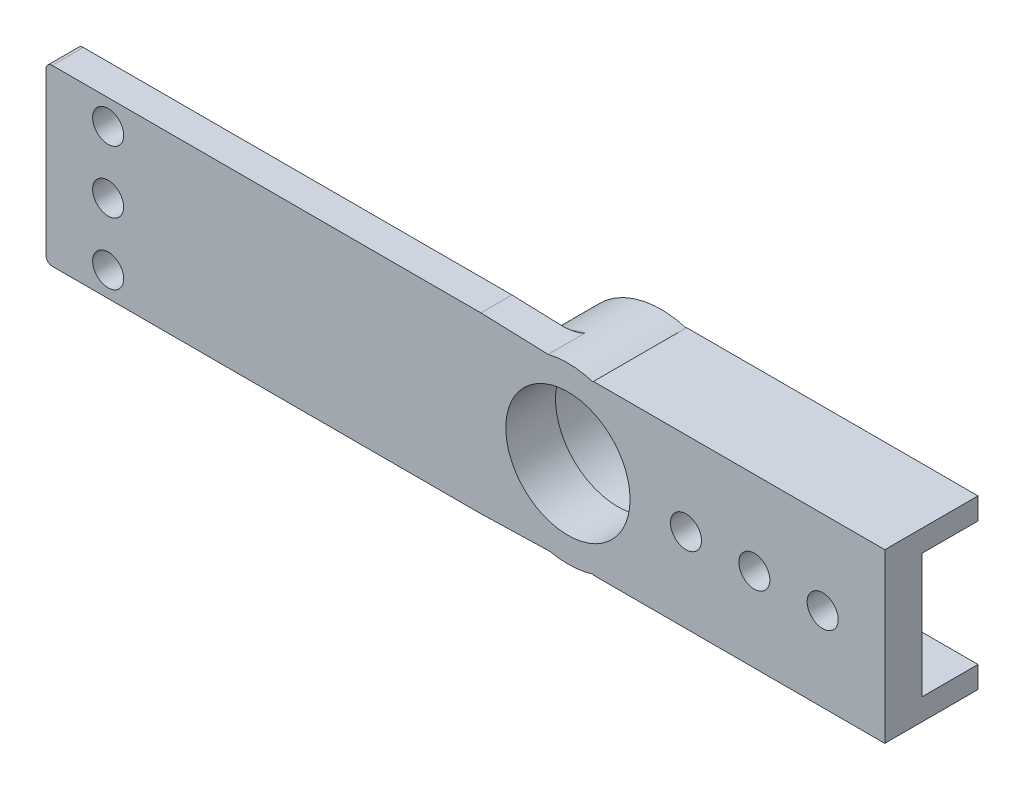
from build123d import *

# Parameters (mm, degrees)
SKETCH_1_W          = 40
SKETCH_1_H          = 20
EXTRUDE_1_DEPTH     = 6
SKETCH_2_R          = 2.5
CUT_EXTRUDE_1_DEPTH = 24.151673806
SKETCH_3_R          = 11
EXTRUDE_2_DEPTH     = 15
SKETCH_5_R          = 11
SKETCH_5_R_2        = 10
EXTRUDE_3_DEPTH     = 8
EXTRUDE_4_DEPTH     = 5
FILLET_1_R          = 1
FILLET_2_R          = 1
SKETCH_9_R          = 2.5
CUT_EXTRUDE_2_DEPTH = 5


with BuildPart() as part:
    # 草图1 → 凸台-拉伸1 (new body)
    with BuildSketch(Plane.XY):
        Rectangle(SKETCH_1_W, SKETCH_1_H)
    extrude(amount=EXTRUDE_1_DEPTH)

    # 草图2 → 切除-拉伸1 (cut, through all)
    with BuildSketch(Plane.XY.offset(6)):
        with Locations((10, 0)):
            Circle(SKETCH_2_R)
        with Locations((-1, 0)):
            Circle(SKETCH_2_R)
        with Locations((-12, 0)):
            Circle(SKETCH_2_R)
    extrude(amount=-CUT_EXTRUDE_1_DEPTH, mode=Mode.SUBTRACT)

    # 草图3 → 凸台-拉伸2 (add)
    with BuildSketch(Plane.XY.offset(6)):
        with BuildLine():
            Line((20, 10), (20, 13.5))
            Line((20, 13.5), (-26.893967141, 13.5))
            Line((-26.893967141, 13.5), (-26.893967141, 13.384337644))
            ThreePointArc((-26.893967141, 13.384337644), (-45, 0), (-26.893967141, -13.384337644))
            Line((-26.893967141, -13.384337644), (-26.893967141, -13.5))
            Line((-26.893967141, -13.5), (20, -13.5))
            Line((20, -13.5), (20, -10))
            Line((20, -10), (-20, -10))
            Line((-20, -10), (-20, -8.660254038))
            ThreePointArc((-20, -8.660254038), (-17, 0), (-20, 8.660254038))
            Line((-20, 8.660254038), (-20, 10))
            Line((-20, 10), (20, 10))
        make_face()
        with Locations((-31, 0)):
            Circle(SKETCH_3_R, mode=Mode.SUBTRACT)
    extrude(amount=-EXTRUDE_2_DEPTH)

    # 草图5 → 凸台-拉伸3 (add)
    with BuildSketch(Plane.XY.offset(6)):
        with Locations((-31, 0)):
            Circle(SKETCH_5_R)
        with Locations((-31, 0)):
            Circle(SKETCH_5_R_2, mode=Mode.SUBTRACT)
    extrude(amount=-EXTRUDE_3_DEPTH)

    # 草图8 → 凸台-拉伸4 (add)
    with BuildSketch(Plane.XY.offset(6)):
        with BuildLine():
            ThreePointArc((-33.911999365, -13.693803697), (-44.999289152, -0.141078849), (-34.187380521, 13.632336755))
            Line((-34.187380521, 13.632336755), (-45, 14))
            Line((-45, 14), (-115, 14))
            Line((-115, 14), (-115, -14))
            Line((-115, -14), (-45, -14))
            Line((-45, -14), (-33.911999365, -13.693803697))
        make_face()
    extrude(amount=-EXTRUDE_4_DEPTH)

    # 圆角1
    fillet_1_edges = [part.edges().sort_by_distance(p)[0] for p in [
        (-44.999289152, -0.141078849, 1),
    ]]
    fillet(fillet_1_edges, radius=FILLET_1_R)

    # 圆角2
    fillet_2_edges = [part.edges().sort_by_distance(p)[0] for p in [
        (-115, 14, 3.5),
        (-115, -14, 3.5),
    ]]
    fillet(fillet_2_edges, radius=FILLET_2_R)

    # 草图9 → 切除-拉伸2 (cut)
    with BuildSketch(Plane.XY.offset(6)):
        with Locations((-105, 0)):
            Circle(SKETCH_9_R)
        with Locations((-105, 10)):
            Circle(SKETCH_9_R)
        with Locations((-105, -10)):
            Circle(SKETCH_9_R)
    extrude(amount=-CUT_EXTRUDE_2_DEPTH, mode=Mode.SUBTRACT)


solid = part.part
